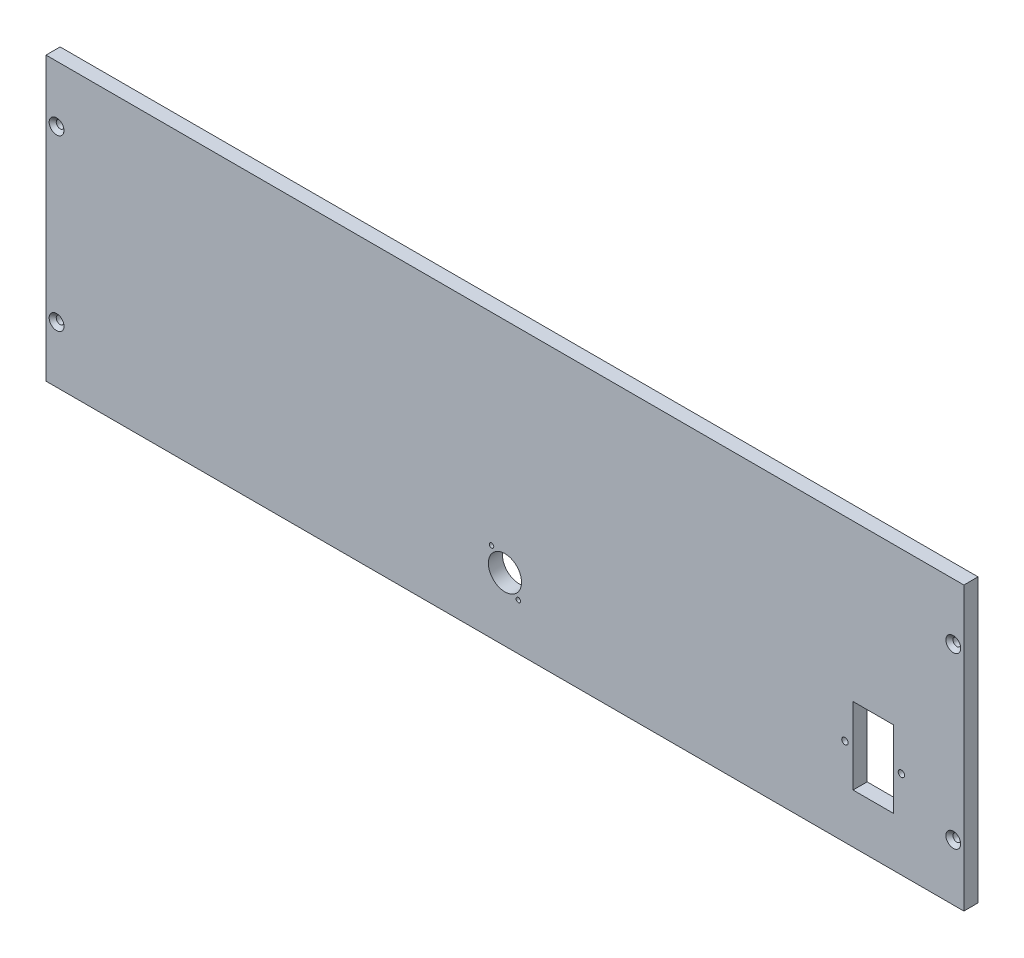
from build123d import *

# Parameters (mm, degrees)
ESQUISSE1_W             = 650
ESQUISSE1_H             = 200
BOSS_EXTRU_1_DEPTH      = 10
ESQUISSE2_R             = 2.75
ENL_V_MAT_EXTRU_1_DEPTH = 10
CHANFREIN1_SIZE         = 2.5
ESQUISSE3_R             = 1.6
ESQUISSE3_R_2           = 11.75
ESQUISSE3_W             = 28.5
ESQUISSE3_H             = 54.3
ESQUISSE3_R_3           = 2.25
ENL_V_MAT_EXTRU_2_DEPTH = 10


with BuildPart() as part:
    # Esquisse1 → Boss.-Extru.1 (new body)
    with BuildSketch(Plane.XY):
        with Locations((325, 100)):
            Rectangle(ESQUISSE1_W, ESQUISSE1_H)
    extrude(amount=BOSS_EXTRU_1_DEPTH)

    # Esquisse2 → Enlèv. mat.-Extru.1 (cut)
    with BuildSketch(Plane.XY.offset(10)):
        with Locations((7.5, 160)):
            Circle(ESQUISSE2_R)
        with Locations((642.5, 160)):
            Circle(ESQUISSE2_R)
        with Locations((7.5, 40)):
            Circle(ESQUISSE2_R)
        with Locations((642.5, 40)):
            Circle(ESQUISSE2_R)
    extrude(amount=-ENL_V_MAT_EXTRU_1_DEPTH, mode=Mode.SUBTRACT)

    # Chanfrein1
    chanfrein1_edges = [part.edges().sort_by_distance(p)[0] for p in [
        (4.75, 160, 10),
        (4.75, 40, 10),
        (639.75, 40, 10),
        (639.75, 160, 10),
    ]]
    chamfer(chanfrein1_edges, length=CHANFREIN1_SIZE)

    # Esquisse3 → Enlèv. mat.-Extru.2 (cut)
    with BuildSketch(Plane.XY.offset(10)):
        with Locations((315.499614794, 56.999404399)):
            Circle(ESQUISSE3_R)
        with Locations((325, 45)):
            Circle(ESQUISSE3_R_2)
        with Locations((334.500385206, 33.000595601)):
            Circle(ESQUISSE3_R)
        with Locations((585.75, 62.15)):
            Rectangle(ESQUISSE3_W, ESQUISSE3_H)
        with Locations((565.75, 62.15)):
            Circle(ESQUISSE3_R_3)
        with Locations((605.75, 62.15)):
            Circle(ESQUISSE3_R_3)
    extrude(amount=-ENL_V_MAT_EXTRU_2_DEPTH, mode=Mode.SUBTRACT)


solid = part.part
